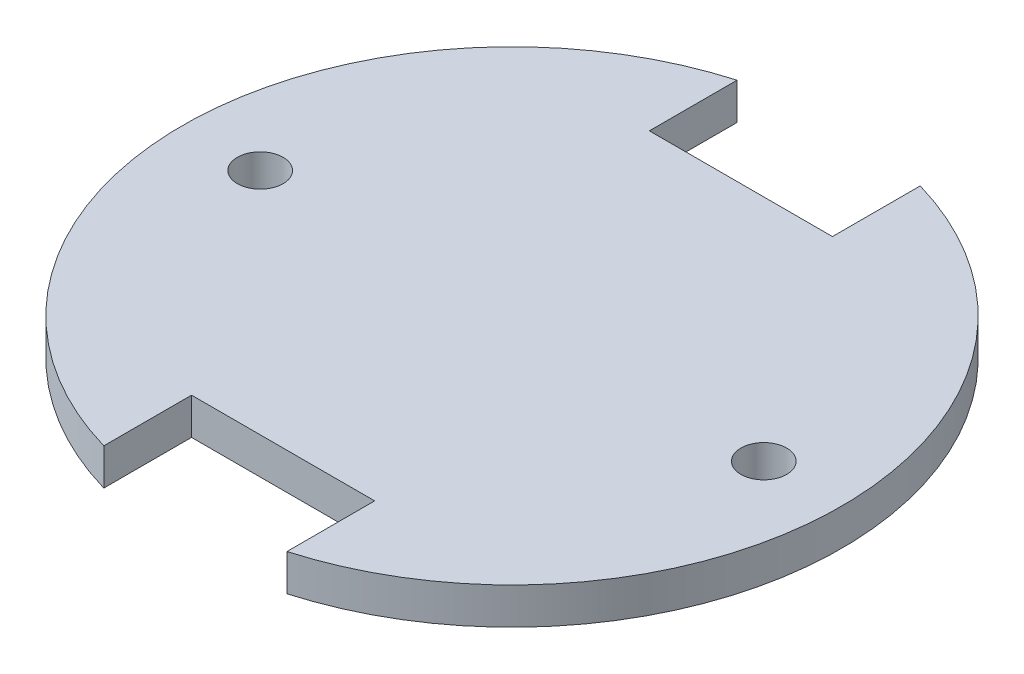
from build123d import *

# Parameters (mm, degrees)
SKETCH1_R           = 2.5
BOSS_EXTRUDE1_DEPTH = 4


with BuildPart() as part:
    # Sketch1 → Boss-Extrude1 (new body)
    with BuildSketch(Plane(origin=(0, 0, 0), x_dir=(1, 0, 0), z_dir=(0, 1, 0))):
        with BuildLine():
            Line((-10, 34.583232932), (-10, 25))
            Line((-10, 25), (10, 25))
            Line((10, 25), (10, 34.583232932))
            ThreePointArc((10, 34.583232932), (36, 0), (10, -34.583232932))
            Line((10, -34.583232932), (10, -25))
            Line((10, -25), (-10, -25))
            Line((-10, -25), (-10, -34.583232932))
            ThreePointArc((-10, -34.583232932), (-36, 0), (-10, 34.583232932))
        make_face()
        with Locations((-27.5, 0)):
            Circle(SKETCH1_R, mode=Mode.SUBTRACT)
        with Locations((27.5, 0)):
            Circle(SKETCH1_R, mode=Mode.SUBTRACT)
    extrude(amount=BOSS_EXTRUDE1_DEPTH)


solid = part.part
